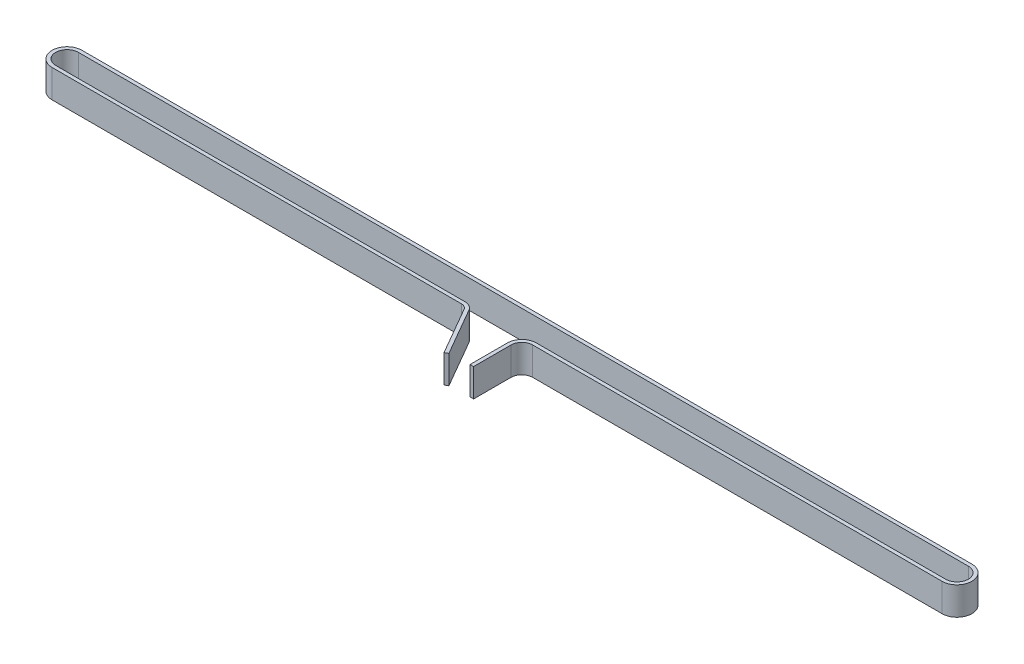
from build123d import *

# Parameters (mm, degrees)
EXTRUDE_THIN1_DEPTH = 12


with BuildPart() as part:
    # Sketch1 → Extrude-Thin1 (new body)
    with BuildSketch(Plane(origin=(0, 0, 0), x_dir=(1, 0, 0), z_dir=(0, 1, 0))):
        with BuildLine():
            Line((189.103076211, -28.129994449), (177.403076211, -7.865))
            ThreePointArc((177.403076211, -7.865), (176.305, -6.766923789), (174.805, -6.365))
            Line((174.805, -6.365), (0, -6.365))
            ThreePointArc((0, -6.365), (-6.365, 0), (0, 6.365))
            Line((0, 6.365), (380, 6.365))
            ThreePointArc((380, 6.365), (386.365, 0), (380, -6.365))
            Line((380, -6.365), (205.195, -6.365))
            ThreePointArc((205.195, -6.365), (201.928873778, -7.717873778), (200.576, -10.984))
            Line((200.576, -10.984), (200.576, -26.984))
            Line((200.576, -26.984), (199.056, -26.984))
            Line((199.056, -26.984), (199.056, -10.984))
            ThreePointArc((199.056, -10.984), (200.85407147, -6.64307147), (205.195, -4.845))
            Line((205.195, -4.845), (380, -4.845))
            ThreePointArc((380, -4.845), (384.845, 0), (380, 4.845))
            Line((380, 4.845), (0, 4.845))
            ThreePointArc((0, 4.845), (-4.845, 0), (0, -4.845))
            Line((0, -4.845), (174.805, -4.845))
            ThreePointArc((174.805, -4.845), (177.065, -5.450565175), (178.719434825, -7.105))
            Line((178.719434825, -7.105), (190.419434825, -27.369994449))
            Line((190.419434825, -27.369994449), (189.103076211, -28.129994449))
        make_face()
    extrude(amount=EXTRUDE_THIN1_DEPTH)


solid = part.part
